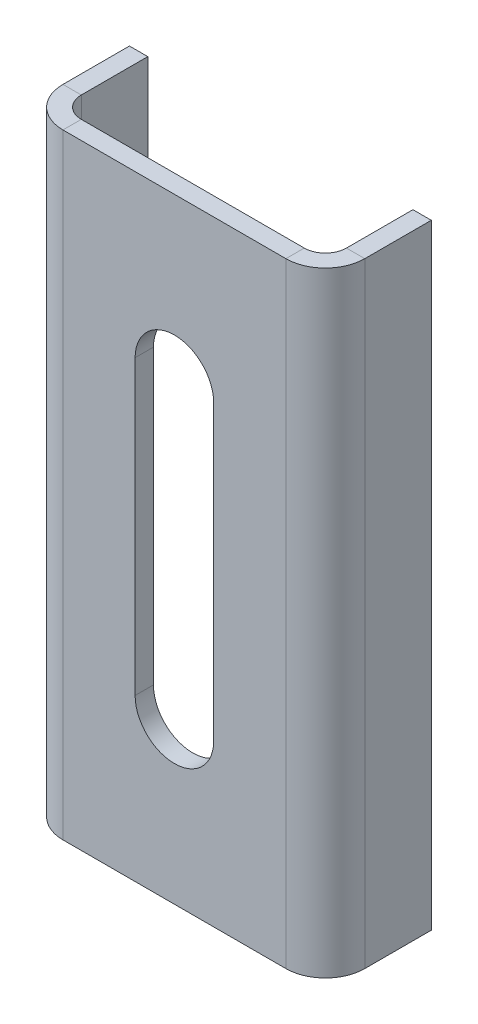
from build123d import *

# Parameters (mm, degrees)
BOSS_EXTRUDE1_DEPTH    = 69.36
CONVERT_SOLID2_DEPTH   = 69.36
CONVERT_SOLID2_2_DEPTH = 69.36
CUT_EXTRUDE1_DEPTH     = 78.896254724


# Read off the part's stored shape, not the designer's step: Convert-Solid2
with BuildPart() as part:
    # Sketch2 → Boss-Extrude1 (new body)
    with BuildSketch(Plane(origin=(0, 0, 0), x_dir=(1, 0, 0), z_dir=(0, 1, 0))):
        Polygon((0, 11.95), (0, 0), (34.05, 0), (34.05, 11.95), (31.98, 11.95), (31.98, 2.07), (2.07, 2.07), (2.07, 11.95), align=None)
    extrude(amount=BOSS_EXTRUDE1_DEPTH)

    # Convert-Solid2 outline → Convert-Solid2 (cut)
    with BuildSketch(Plane(origin=(0, 0, 0), x_dir=(1, 0, 0), z_dir=(0, 1, 0))):
        with BuildLine():
            ThreePointArc((34.05, 4.450000066), (32.746625157, 1.303374843), (29.599999934, 0))
            Line((29.599999934, 0), (34.05, 0))
            Line((34.05, 0), (34.05, 4.450000066))
        make_face()
        with BuildLine():
            Line((0, 0), (4.450000066, 0))
            ThreePointArc((4.450000066, 0), (1.303374843, 1.303374843), (0, 4.450000066))
            Line((0, 4.450000066), (0, 0))
        make_face()
    extrude(amount=CONVERT_SOLID2_DEPTH, mode=Mode.SUBTRACT)

    # Convert-Solid2 2 outline → Convert-Solid2 2 (add)
    with BuildSketch(Plane(origin=(0, 0, 0), x_dir=(1, 0, 0), z_dir=(0, 1, 0))):
        with BuildLine():
            Line((2.07, 2.07), (4.450000066, 2.07))
            ThreePointArc((4.450000066, 2.07), (2.76708588, 2.76708588), (2.07, 4.450000066))
            Line((2.07, 4.450000066), (2.07, 2.07))
        make_face()
        with BuildLine():
            ThreePointArc((31.98, 4.450000066), (31.28291412, 2.76708588), (29.599999934, 2.07))
            Line((29.599999934, 2.07), (31.98, 2.07))
            Line((31.98, 2.07), (31.98, 4.450000066))
        make_face()
    extrude(amount=CONVERT_SOLID2_2_DEPTH)

    # Sketch12 → Cut-Extrude1 (cut, through all)
    with BuildSketch(Plane(origin=(0, 0, -2.07), x_dir=(-1, 0, 0), z_dir=(0, 0, -1))):
        with BuildLine():
            Line((-21.46, 18.18), (-21.46, 51.18))
            ThreePointArc((-21.46, 51.18), (-17.025, 55.615), (-12.59, 51.18))
            Line((-12.59, 51.18), (-12.59, 18.18))
            ThreePointArc((-12.59, 18.18), (-17.025, 13.745), (-21.46, 18.18))
        make_face()
    extrude(amount=-CUT_EXTRUDE1_DEPTH, mode=Mode.SUBTRACT)


solid = part.part
